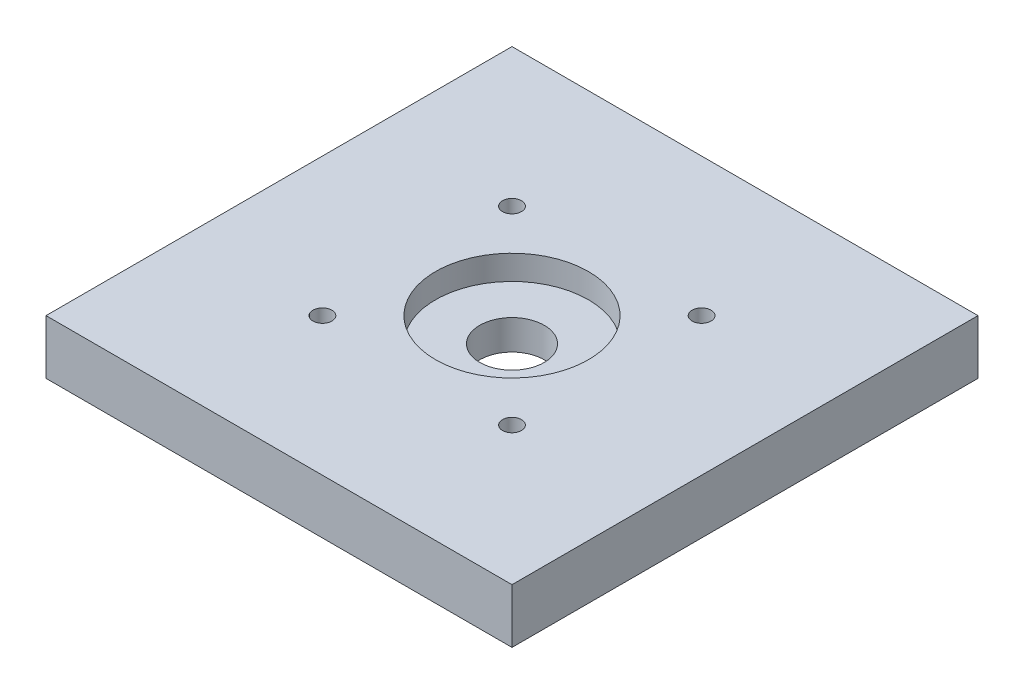
from build123d import *

# Parameters (mm, degrees)
SKETCH1_W           = 76.2
SKETCH1_H           = 76.2
SKETCH1_R           = 1.55
SKETCH1_R_2         = 5.2705
BOSS_EXTRUDE1_DEPTH = 8.89
SKETCH2_R           = 12.5
CUT_EXTRUDE1_DEPTH  = 4


with BuildPart() as part:
    # Sketch1 → Boss-Extrude1 (new body)
    with BuildSketch(Plane(origin=(0, 0, 0), x_dir=(1, 0, 0), z_dir=(0, 1, 0))):
        Rectangle(SKETCH1_W, SKETCH1_H)
        with Locations((-15.5, -15.5)):
            Circle(SKETCH1_R, mode=Mode.SUBTRACT)
        with Locations((15.5, -15.5)):
            Circle(SKETCH1_R, mode=Mode.SUBTRACT)
        Circle(SKETCH1_R_2, mode=Mode.SUBTRACT)
        with Locations((-15.5, 15.5)):
            Circle(SKETCH1_R, mode=Mode.SUBTRACT)
        with Locations((15.5, 15.5)):
            Circle(SKETCH1_R, mode=Mode.SUBTRACT)
    extrude(amount=BOSS_EXTRUDE1_DEPTH)

    # Sketch2 → Cut-Extrude1 (cut)
    with BuildSketch(Plane(origin=(0, 8.89, 0), x_dir=(1, 0, 0), z_dir=(0, 1, 0))):
        Circle(SKETCH2_R)
    extrude(amount=-CUT_EXTRUDE1_DEPTH, mode=Mode.SUBTRACT)


solid = part.part
